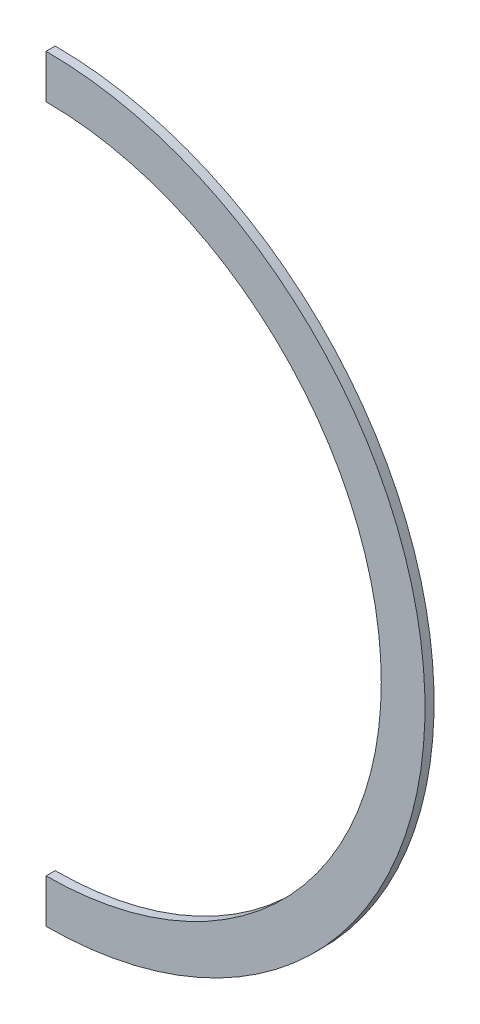
from build123d import *

# Parameters (mm, degrees)
SKETCH2_R           = 116.84
BOSS_EXTRUDE1_DEPTH = 1.5875
SKETCH3_W           = 232.210592103
SKETCH3_H           = 398.954583541
CUT_EXTRUDE1_DEPTH  = 190.3271535


with BuildPart() as part:
    # Sketch2 → Boss-Extrude1 (new, symmetric)
    with BuildSketch(Plane.XY):
        with BuildLine():
            ThreePointArc((-1.651, 128.513680847), (-113.44208216, 64.09028885), (-116.977106193, -64.886930424))
            ThreePointArc((-116.977106193, -64.886930424), (-116.59127356, -65.61727077), (-116.200881143, -66.345183954))
            ThreePointArc((-116.200881143, -66.345183954), (-115.806084025, -67.070386581), (-115.406761019, -67.793106963))
            ThreePointArc((-115.406761019, -67.793106963), (0, -135.636), (115.406761019, -67.793106963))
            ThreePointArc((115.406761019, -67.793106963), (115.804512811, -67.073251299), (116.197774523, -66.350932884))
            ThreePointArc((116.197774523, -66.350932884), (116.589738292, -65.620154913), (116.977106193, -64.886930424))
            ThreePointArc((116.977106193, -64.886930424), (113.44208216, 64.09028885), (1.651, 128.513680847))
            ThreePointArc((1.651, 128.513680847), (0.825516124, 128.521420187), (0, 128.524))
            ThreePointArc((0, 128.524), (-0.825516124, 128.521420187), (-1.651, 128.513680847))
        make_face()
        with Locations((0, -3.556)):
            Circle(SKETCH2_R, mode=Mode.SUBTRACT)
    extrude(amount=BOSS_EXTRUDE1_DEPTH, both=True)

    # Sketch3 → Cut-Extrude1 (cut, through all)
    with BuildSketch(Plane(origin=(0, 0, 0), x_dir=(0, 0, -1), z_dir=(1, 0, 0))):
        with Locations((6.714523145, -6.913261573)):
            Rectangle(SKETCH3_W, SKETCH3_H)
    extrude(amount=-CUT_EXTRUDE1_DEPTH, mode=Mode.SUBTRACT)


solid = part.part
